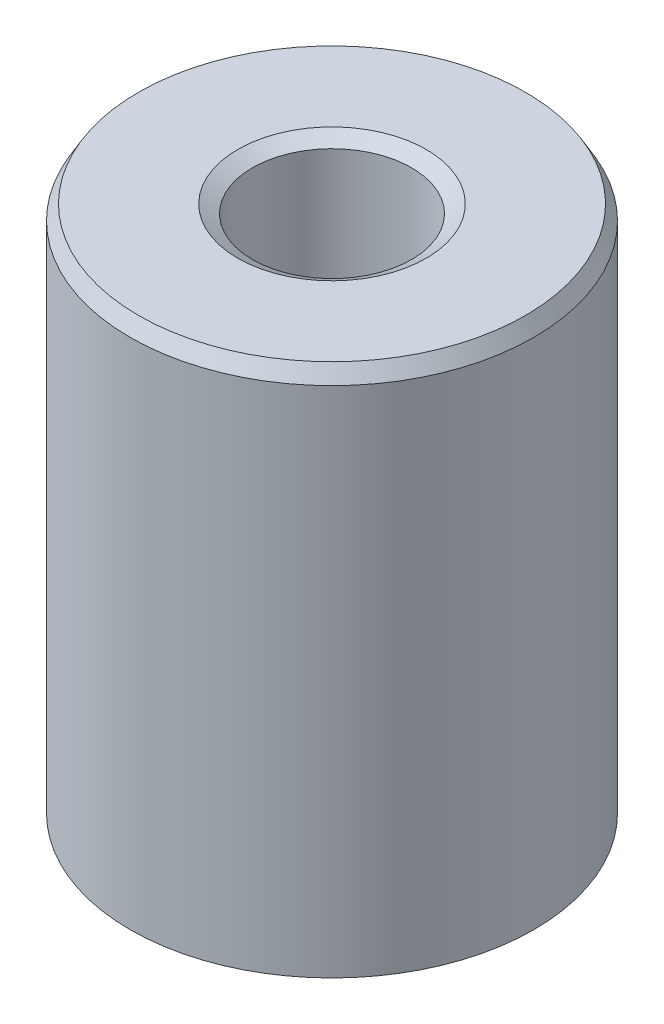
from build123d import *
from OCP.BRepFilletAPI import BRepFilletAPI_MakeChamfer

# Parameters (mm, degrees)
SKETCH1_R           = 50
BOSS_EXTRUDE1_DEPTH = 132.781201109
SKETCH2_R           = 19.707200992
CUT_EXTRUDE1_DEPTH  = 151.435525618
CHAMFER1_SIZE       = 3.637232317
CHAMFER1_SIZE2      = 2.099957057


with BuildPart() as part:
    # Sketch1 → Boss-Extrude1 (new body)
    with BuildSketch(Plane(origin=(0, 0, 0), x_dir=(1, 0, 0), z_dir=(0, 1, 0))):
        Circle(SKETCH1_R)
    extrude(amount=BOSS_EXTRUDE1_DEPTH)

    # Sketch2 → Cut-Extrude1 (cut, through all)
    with BuildSketch(Plane(origin=(0, 0, 0), x_dir=(1, 0, 0), z_dir=(0, 1, 0))):
        Circle(SKETCH2_R)
    extrude(amount=CUT_EXTRUDE1_DEPTH, mode=Mode.SUBTRACT)

    # Chamfer1: one chamfer whose edges measure the first distance from different faces: ONE call of the kernel's chamfer builder (chamfer() names one face for all edges)
    chamfer1_edges_1 = [part.edges().sort_by_distance(p)[0] for p in [
        (-19.707200992, 132.781201109, 0),
    ]]
    chamfer1_side_1 = [part.faces().sort_by_distance(p)[0] for p in [
        (-48.585786438, 132.781201109, 0),
    ]]
    chamfer1_edges_2 = [part.edges().sort_by_distance(p)[0] for p in [
        (-19.707200992, 0, 0),
    ]]
    chamfer1_side_2 = [part.faces().sort_by_distance(p)[0] for p in [
        (-19.707200992, 66.390600554, 0),
    ]]
    chamfer1_edges_3 = [part.edges().sort_by_distance(p)[0] for p in [
        (-50, 0, 0),
    ]]
    chamfer1_side_3 = [part.faces().sort_by_distance(p)[0] for p in [
        (-48.585786438, 0, 0),
    ]]
    chamfer1_edges_4 = [part.edges().sort_by_distance(p)[0] for p in [
        (-50, 132.781201109, 0),
    ]]
    chamfer1_side_4 = [part.faces().sort_by_distance(p)[0] for p in [
        (-50, 66.390600554, 0),
    ]]
    chamfer1 = BRepFilletAPI_MakeChamfer(part.part.solid().wrapped)
    for e in chamfer1_edges_1:
        chamfer1.Add(CHAMFER1_SIZE, CHAMFER1_SIZE2, e.wrapped, chamfer1_side_1[0].wrapped)  # the first distance lies on this face
    for e in chamfer1_edges_2:
        chamfer1.Add(CHAMFER1_SIZE, CHAMFER1_SIZE2, e.wrapped, chamfer1_side_2[0].wrapped)  # the first distance lies on this face
    for e in chamfer1_edges_3:
        chamfer1.Add(CHAMFER1_SIZE, CHAMFER1_SIZE2, e.wrapped, chamfer1_side_3[0].wrapped)  # the first distance lies on this face
    for e in chamfer1_edges_4:
        chamfer1.Add(CHAMFER1_SIZE, CHAMFER1_SIZE2, e.wrapped, chamfer1_side_4[0].wrapped)  # the first distance lies on this face
    add(Compound.cast(chamfer1.Shape()), mode=Mode.REPLACE)


solid = part.part
